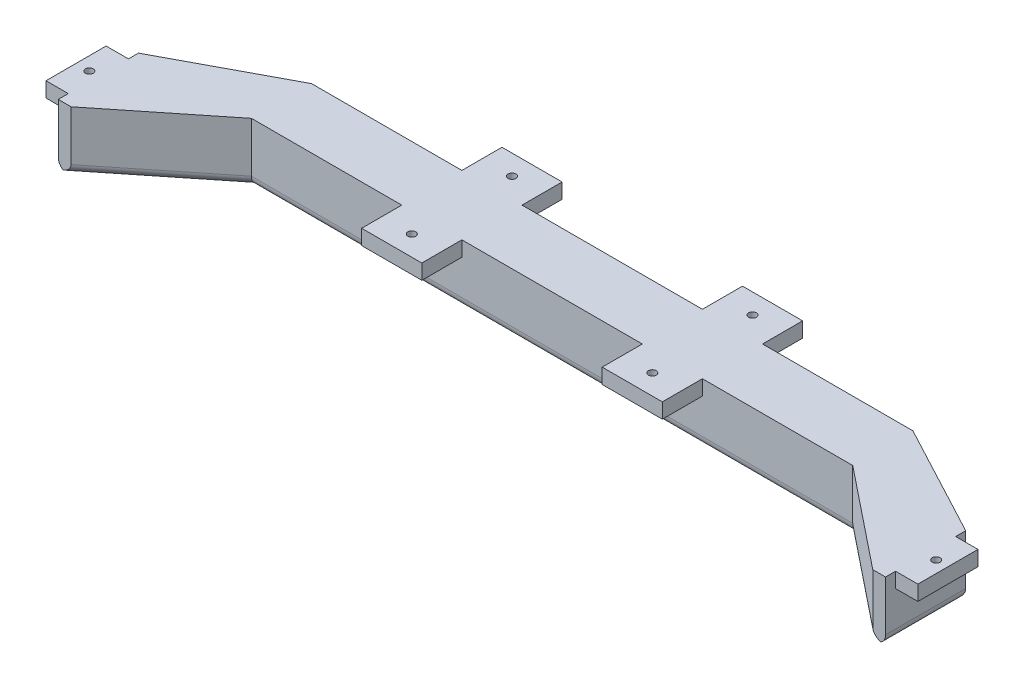
from build123d import *

# Parameters (mm, degrees)
SKETCH1_W                                = 1524
SKETCH1_H                                = 152.4
BOSS_EXTRUDE1_DEPTH                      = 152.4
BOSS_EXTRUDE2_DEPTH                      = 152.4
FILLET1_R                                = 25.4
SKETCH9_W                                = 152.4
SKETCH9_H                                = 38.1
BOSS_EXTRUDE3_DEPTH                      = 101.6
SKETCH11_W                               = 152.4
SKETCH11_H                               = 38.1
BOSS_EXTRUDE4_DEPTH                      = 56.515
F_0000_CLEARANCE_HOLE1_D                 = 7.874
F_0000_CLEARANCE_HOLE1_DEPTH             = 12.7
F_0000_CLEARANCE_HOLE1_TIP               = 2.365588257
CBORE_FOR_3_4_HEX_HEAD_BOLT1_D           = 19.84248
CBORE_FOR_3_4_HEX_HEAD_BOLT1_CBORE_D     = 41.275
CBORE_FOR_3_4_HEX_HEAD_BOLT1_CBORE_DEPTH = 13.3096


with BuildPart() as part:
    # Sketch1 → Boss-Extrude1 (new body)
    with BuildSketch(Plane.XY):
        with Locations((762, 76.2)):
            Rectangle(SKETCH1_W, SKETCH1_H)
    extrude(amount=BOSS_EXTRUDE1_DEPTH)

    # Sketch8 → Boss-Extrude2 (add)
    with BuildSketch(Plane(origin=(0, 152.4, 0), x_dir=(1, 0, 0), z_dir=(0, 1, 0))):
        Polygon((0, -152.4), (-254, -355.6), (-286.356492461, -355.6), (-286.356492461, -152.4), (0, 0), align=None)
    boss_extrude2 = extrude(amount=-BOSS_EXTRUDE2_DEPTH)

    # Mirror1: Boss-Extrude2 across plane
    add(boss_extrude2.mirror(Plane(origin=(762, 0, 0), x_dir=(0, 0, 1), z_dir=(1, 0, 0))))

    # Fillet1
    # the kernel refuses this fillet: 25.4 mm, written as the material it takes off along each edge
    with BuildSketch(Plane(origin=(-342.412174328, 0, 182.23304427), x_dir=(0, 1, 0), z_dir=(0.882766643577138, 0, -0.4698117207856294))) as fillet1_piece_1:
        with BuildLine():
            CenterArc((FILLET1_R, FILLET1_R), FILLET1_R, 180, 90)
            Line((0, FILLET1_R), (0, 0))
            Line((0, 0), (FILLET1_R, 0))
        make_face()
    extrude(amount=451.385265964, mode=Mode.SUBTRACT)
    with BuildSketch(Plane(origin=(-286.356492461, 0, 419.1), x_dir=(0, 1, 0), z_dir=(0, 0, -1))) as fillet1_piece_2:
        with BuildLine():
            CenterArc((FILLET1_R, FILLET1_R), FILLET1_R, 180, 90)
            Line((0, FILLET1_R), (0, 0))
            Line((0, 0), (FILLET1_R, 0))
        make_face()
    extrude(amount=330.2, mode=Mode.SUBTRACT)
    with BuildSketch(Plane(origin=(49.5851694, 0, 112.73186448), x_dir=(0, 1, 0), z_dir=(-0.780868809443027, 0, 0.6246950475544286))) as fillet1_piece_3_section:
        with BuildLine():
            CenterArc((FILLET1_R, FILLET1_R), FILLET1_R, 180, 90)
            Line((0, FILLET1_R), (0, 0))
            Line((0, 0), (FILLET1_R, 0))
        make_face()
    fillet1_piece_3 = extrude(amount=452.278711262, mode=Mode.PRIVATE)
    fillet1_piece_3 = split(fillet1_piece_3, bisect_by=Plane(origin=(-158.082016781, 5.808462647, 152.4), z_dir=(0, 0, 1)), keep=Keep.TOP, mode=Mode.PRIVATE)
    add(fillet1_piece_3, mode=Mode.SUBTRACT)
    with BuildSketch(Plane(origin=(-63.5, 0, 152.4), x_dir=(0, 1, 0), z_dir=(1, 0, 0))) as fillet1_piece_4_section:
        with BuildLine():
            CenterArc((FILLET1_R, -FILLET1_R), FILLET1_R, 90, 90)
            Line((0, -FILLET1_R), (0, 0))
            Line((0, 0), (FILLET1_R, 0))
        make_face()
    fillet1_piece_4 = extrude(amount=1651, mode=Mode.PRIVATE)
    fillet1_piece_4 = split(fillet1_piece_4, bisect_by=Plane(origin=(467.415014496, 5.779770976, -221.532011596), z_dir=(0.6246950475544286, 0, 0.780868809443027)), keep=Keep.TOP, mode=Mode.PRIVATE)
    fillet1_piece_4 = split(fillet1_piece_4, bisect_by=Plane(origin=(1056.584985505, 5.779770976, -221.532011596), z_dir=(-0.6246950475544286, 0, 0.780868809443027)), keep=Keep.TOP, mode=Mode.PRIVATE)
    add(fillet1_piece_4, mode=Mode.SUBTRACT)
    with BuildSketch(Plane(origin=(1474.4148306, 0, 112.73186448), x_dir=(0, 1, 0), z_dir=(0.780868809443027, 0, 0.6246950475544286))) as fillet1_piece_5_section:
        with BuildLine():
            CenterArc((FILLET1_R, -FILLET1_R), FILLET1_R, 90, 90)
            Line((0, -FILLET1_R), (0, 0))
            Line((0, 0), (FILLET1_R, 0))
        make_face()
    fillet1_piece_5 = extrude(amount=452.278711262, mode=Mode.PRIVATE)
    fillet1_piece_5 = split(fillet1_piece_5, bisect_by=Plane(origin=(1682.082016781, 5.808462647, 152.4), z_dir=(0, 0, 1)), keep=Keep.TOP, mode=Mode.PRIVATE)
    add(fillet1_piece_5, mode=Mode.SUBTRACT)
    with BuildSketch(Plane(origin=(1810.356492461, 0, 419.1), x_dir=(0, 1, 0), z_dir=(0, 0, -1))) as fillet1_piece_6:
        with BuildLine():
            CenterArc((FILLET1_R, -FILLET1_R), FILLET1_R, 90, 90)
            Line((0, -FILLET1_R), (0, 0))
            Line((0, 0), (FILLET1_R, 0))
        make_face()
    extrude(amount=330.2, mode=Mode.SUBTRACT)
    with BuildSketch(Plane(origin=(1866.412174328, 0, 182.23304427), x_dir=(0, 1, 0), z_dir=(-0.882766643577138, 0, -0.4698117207856294))) as fillet1_piece_7:
        with BuildLine():
            CenterArc((FILLET1_R, -FILLET1_R), FILLET1_R, 90, 90)
            Line((0, -FILLET1_R), (0, 0))
            Line((0, 0), (FILLET1_R, 0))
        make_face()
    extrude(amount=451.385265964, mode=Mode.SUBTRACT)
    with BuildSketch(Plane(origin=(-63.5, 0, 0), x_dir=(0, 1, 0), z_dir=(1, 0, 0))) as fillet1_piece_8:
        with BuildLine():
            CenterArc((FILLET1_R, FILLET1_R), FILLET1_R, 180, 90)
            Line((0, FILLET1_R), (0, 0))
            Line((0, 0), (FILLET1_R, 0))
        make_face()
    extrude(amount=1651, mode=Mode.SUBTRACT)
    with BuildSketch(Plane(origin=(-63.5, 0, 152.4), x_dir=(0, 1, 0), z_dir=(1, 0, 0))) as fillet1_piece_9a_section:
        with BuildLine():
            CenterArc((FILLET1_R, -FILLET1_R), FILLET1_R, 90, 90)
            Line((0, -FILLET1_R), (0, 0))
            Line((0, 0), (FILLET1_R, 0))
        make_face()
    fillet1_piece_9a = extrude(amount=1651, mode=Mode.PRIVATE)
    fillet1_piece_9a = split(fillet1_piece_9a, bisect_by=Plane(origin=(-13.902468194, 5.43719391, 163.521974555), z_dir=(-0.6246950475544286, 0, -0.780868809443027)), keep=Keep.TOP, mode=Mode.PRIVATE)
    with BuildSketch(Plane(origin=(49.5851694, 0, 112.73186448), x_dir=(0, 1, 0), z_dir=(-0.780868809443027, 0, 0.6246950475544286))) as fillet1_piece_9b_section:
        with BuildLine():
            CenterArc((FILLET1_R, FILLET1_R), FILLET1_R, 180, 90)
            Line((0, FILLET1_R), (0, 0))
            Line((0, 0), (FILLET1_R, 0))
        make_face()
    fillet1_piece_9b = extrude(amount=452.278711262, mode=Mode.PRIVATE)
    fillet1_piece_9b = split(fillet1_piece_9b, bisect_by=Plane(origin=(17.80384621, 5.43719391, 152.4), z_dir=(0, 0, -1)), keep=Keep.TOP, mode=Mode.PRIVATE)
    fillet1_piece_9 = fillet1_piece_9a & fillet1_piece_9b
    add(fillet1_piece_9, mode=Mode.SUBTRACT)
    with BuildSketch(Plane(origin=(-63.5, 0, 152.4), x_dir=(0, 1, 0), z_dir=(1, 0, 0))) as fillet1_piece_10a_section:
        with BuildLine():
            CenterArc((FILLET1_R, -FILLET1_R), FILLET1_R, 90, 90)
            Line((0, -FILLET1_R), (0, 0))
            Line((0, 0), (FILLET1_R, 0))
        make_face()
    fillet1_piece_10a = extrude(amount=1651, mode=Mode.PRIVATE)
    fillet1_piece_10a = split(fillet1_piece_10a, bisect_by=Plane(origin=(1537.902468194, 5.43719391, 163.521974555), z_dir=(0.6246950475544286, 0, -0.780868809443027)), keep=Keep.TOP, mode=Mode.PRIVATE)
    with BuildSketch(Plane(origin=(1474.4148306, 0, 112.73186448), x_dir=(0, 1, 0), z_dir=(0.780868809443027, 0, 0.6246950475544286))) as fillet1_piece_10b_section:
        with BuildLine():
            CenterArc((FILLET1_R, -FILLET1_R), FILLET1_R, 90, 90)
            Line((0, -FILLET1_R), (0, 0))
            Line((0, 0), (FILLET1_R, 0))
        make_face()
    fillet1_piece_10b = extrude(amount=452.278711262, mode=Mode.PRIVATE)
    fillet1_piece_10b = split(fillet1_piece_10b, bisect_by=Plane(origin=(1506.19615379, 5.43719391, 152.4), z_dir=(0, 0, -1)), keep=Keep.TOP, mode=Mode.PRIVATE)
    fillet1_piece_10 = fillet1_piece_10a & fillet1_piece_10b
    add(fillet1_piece_10, mode=Mode.SUBTRACT)

    # Sketch9 → Boss-Extrude3 (add)
    with BuildSketch(Plane(origin=(0, 0, 0), x_dir=(-1, 0, 0), z_dir=(0, 0, -1))):
        with Locations((-457.2, 133.35)):
            Rectangle(SKETCH9_W, SKETCH9_H)
        with Locations((-1066.8, 133.35)):
            Rectangle(SKETCH9_W, SKETCH9_H)
    boss_extrude3 = extrude(amount=BOSS_EXTRUDE3_DEPTH)

    # Sketch11 → Boss-Extrude4 (add)
    with BuildSketch(Plane.ZY.offset(286.356492461)):
        with Locations((254, 133.35)):
            Rectangle(SKETCH11_W, SKETCH11_H)
    boss_extrude4 = extrude(amount=BOSS_EXTRUDE4_DEPTH)

    # Mirror3: Boss-Extrude4 across plane
    add(boss_extrude4.mirror(Plane(origin=(762, 0, 0), x_dir=(0, 0, 1), z_dir=(1, 0, 0))))

    # Mirror4: Boss-Extrude3 across plane
    add(boss_extrude3.mirror(Plane.XY.offset(76.2)))

    # #0000 Clearance Hole1
    with Locations(Plane(origin=(0, 0, 0), x_dir=(-1, 0, 0), z_dir=(0, -1, 0))):
        with Locations((222.856492461, -231.155200669), (19.656492461, -82.394199052), (-175.923507539, -76.2), (-371.503507539, -76.2), (-567.083507539, -76.2), (-762.028507539, -76.2), (-956.916492461, -76.2), (-1152.496492461, -76.2), (-1348.076492461, -76.2), (-1543.656492461, -76.2), (-1746.856492461, -231.155200669)):
            Hole(F_0000_CLEARANCE_HOLE1_D / 2, depth=F_0000_CLEARANCE_HOLE1_DEPTH)
            with Locations((0, 0, -(F_0000_CLEARANCE_HOLE1_DEPTH + F_0000_CLEARANCE_HOLE1_TIP / 2))):  # 118° drill point
                Cone(0, F_0000_CLEARANCE_HOLE1_D / 2, F_0000_CLEARANCE_HOLE1_TIP, mode=Mode.SUBTRACT)

    # CBORE for 3/4 Hex Head Bolt1 (through all)
    with Locations(Plane(origin=(0, 114.3, 0), x_dir=(-1, 0, 0), z_dir=(0, -1, 0))):
        with Locations((-457.2, 50.8), (-457.2, -203.2), (-1066.8, 50.8), (-1066.8, -203.2), (-1837.083507539, -254), (309.216492461, -254)):
            CounterBoreHole(CBORE_FOR_3_4_HEX_HEAD_BOLT1_D / 2, CBORE_FOR_3_4_HEX_HEAD_BOLT1_CBORE_D / 2, CBORE_FOR_3_4_HEX_HEAD_BOLT1_CBORE_DEPTH)


solid = part.part
